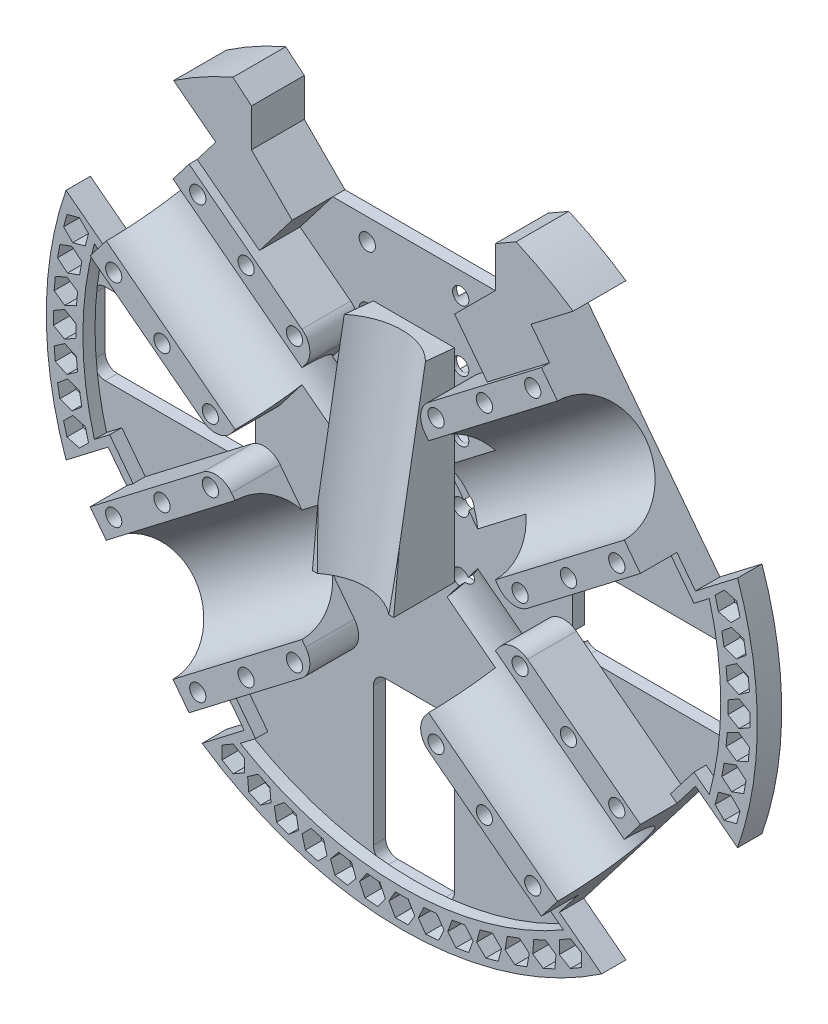
from build123d import *
from build123d.topology import SkipClean

# Parameters (mm, degrees)
SKETCH1_R                                  = 87.5
BOSS_EXTRUDE1_DEPTH                        = 3
CUT_EXTRUDE1_DEPTH                         = 3
BOSS_EXTRUDE2_DEPTH                        = 12
SKETCH4_R                                  = 13.5
CUT_EXTRUDE2_DEPTH                         = 55
SKETCH5_R                                  = 2
CUT_EXTRUDE3_DEPTH                         = 125.649508623
LPATTERN1_COUNT                            = 3
LPATTERN1_PITCH                            = 15
MIRROR3_COPY_1_SKETCH_R                    = 2
MIRROR3_COPY_1_DEPTH                       = 125.649508623
MIRROR3_COPY_2_SKETCH_R                    = 2
MIRROR3_COPY_2_DEPTH                       = 125.649508623
MIRROR3_AT_THE_SECOND_PLANE_COPY_1_SKETC_R = 2
MIRROR3_AT_THE_SECOND_PLANE_COPY_1_DEPTH   = 125.649508623
MIRROR3_AT_THE_SECOND_PLANE_COPY_2_SKETC_R = 2
MIRROR3_AT_THE_SECOND_PLANE_COPY_2_DEPTH   = 125.649508623
MIRROR3_AT_THE_SECOND_PLANE_COPY_3_DEPTH   = 3
MIRROR3_AT_THE_SECOND_PLANE_COPY_4_DEPTH   = 12
MIRROR3_AT_THE_SECOND_PLANE_COPY_5_SKETC_R = 13.5
MIRROR3_AT_THE_SECOND_PLANE_COPY_5_DEPTH   = 55
MIRROR3_AT_THE_SECOND_PLANE_COPY_6_SKETC_R = 2
MIRROR3_AT_THE_SECOND_PLANE_COPY_6_DEPTH   = 125.649508623
MIRROR3_AT_THE_SECOND_PLANE_COPY_7_SKETC_R = 2
MIRROR3_AT_THE_SECOND_PLANE_COPY_7_DEPTH   = 125.649508623
MIRROR3_AT_THE_SECOND_PLANE_COPY_8_SKETC_R = 2
MIRROR3_AT_THE_SECOND_PLANE_COPY_8_DEPTH   = 125.649508623
FILLET2_R                                  = 5
BOSS_EXTRUDE3_DEPTH                        = 3
SKETCH8_R                                  = 1.75
CUT_EXTRUDE4_DEPTH                         = 125.07054445
CUT_EXTRUDE5_DEPTH                         = 4
CIRPATTERN1_COUNT                          = 4
CIRPATTERN1_ANGLE                          = 15
CIRPATTERN1_THE_OTHER_WAY_COUNT            = 4
CIRPATTERN1_THE_OTHER_WAY_ANGLE            = 15
MIRROR4_COPY_1_SKETCH_R                    = 1.75
MIRROR4_COPY_1_DEPTH                       = 125.07054445
MIRROR4_COPY_2_SKETCH_R                    = 1.75
MIRROR4_COPY_2_DEPTH                       = 125.07054445
MIRROR4_COPY_3_SKETCH_R                    = 1.75
MIRROR4_COPY_3_DEPTH                       = 125.07054445
MIRROR4_COPY_4_DEPTH                       = 4
MIRROR4_COPY_5_DEPTH                       = 4
MIRROR4_COPY_6_DEPTH                       = 4
MIRROR4_COPY_7_SKETCH_R                    = 1.75
MIRROR4_COPY_7_DEPTH                       = 125.07054445
MIRROR4_COPY_8_SKETCH_R                    = 1.75
MIRROR4_COPY_8_DEPTH                       = 125.07054445
MIRROR4_COPY_9_SKETCH_R                    = 1.75
MIRROR4_COPY_9_DEPTH                       = 125.07054445
MIRROR4_COPY_10_DEPTH                      = 4
MIRROR4_COPY_11_DEPTH                      = 4
MIRROR4_COPY_12_DEPTH                      = 4
BOSS_EXTRUDE4_DEPTH                        = 3
SKETCH11_R                                 = 1.75
CUT_EXTRUDE6_DEPTH                         = 125.07054445
CUT_EXTRUDE7_DEPTH                         = 4
CIRPATTERN2_COUNT                          = 7
CIRPATTERN2_ANGLE                          = 30
CIRPATTERN2_THE_OTHER_WAY_COUNT            = 7
CIRPATTERN2_THE_OTHER_WAY_ANGLE            = 30
CUT_EXTRUDE8_DEPTH                         = 125.324173032
BOSS_EXTRUDE5_DEPTH                        = 3
CUT_EXTRUDE9_DEPTH                         = 125.324173032
CHAMFER2_SIZE                              = 5.648359349
CHAMFER2_SIZE_2                            = 5
BOSS_EXTRUDE6_DEPTH                        = 10
BOSS_EXTRUDE6_DEPTH_BACK                   = 10
CUT_SWEEP1_PROFILE_R                       = 14
BOSS_EXTRUDE8_DEPTH                        = 10
CUT_EXTRUDE10_DEPTH                        = 2
SKETCH41_R                                 = 2
CUT_EXTRUDE11_DEPTH                        = 125.649508623
LPATTERN2_COUNT                            = 5
LPATTERN2_PITCH                            = 15
CUT_EXTRUDE12_START                        = -2
CUT_EXTRUDE12_DEPTH                        = 2


with BuildPart() as part:
    # Sketch1 → Boss-Extrude1 (new body)
    with BuildSketch(Plane.XY):
        Circle(SKETCH1_R)
    extrude(amount=BOSS_EXTRUDE1_DEPTH)

    # Sketch2 → Cut-Extrude1 (cut)
    with BuildSketch(Plane.XY.offset(3)):
        Polygon((-100.043040028, 42.102733188), (-72.275673118, 20.796083173), (-38.793794523, 64.430516889), (-66.561161433, 85.737166904), align=None)
    cut_extrude1 = extrude(amount=-CUT_EXTRUDE1_DEPTH, mode=Mode.SUBTRACT)

    # Sketch3 → Boss-Extrude2 (add)
    with BuildSketch(Plane.XY.offset(3)):
        Polygon((-35.975828789, 2.395776064), (-67.709962401, 26.746233225), (-43.35950524, 58.480366836), (-11.625371629, 34.129909676), align=None)
    boss_extrude2 = extrude(amount=BOSS_EXTRUDE2_DEPTH)

    # Sketch4 → Cut-Extrude2 (cut)
    with BuildSketch(Plane(origin=(-55.53473382, 42.613300031, 0), x_dir=(0, 0, 1), z_dir=(-0.7933533402912385, 0.6087614290087163, 0))):
        with Locations((15, 0)):
            Circle(SKETCH4_R)
    cut_extrude2 = extrude(amount=-CUT_EXTRUDE2_DEPTH, mode=Mode.SUBTRACT)

    # Sketch5 → Cut-Extrude3 (cut, through all)
    with BuildSketch(Plane.XY.offset(15)):
        with Locations((-61.916911412, 26.082486101)):
            Circle(SKETCH5_R)
        with Locations((-41.219022826, 53.056499671)):
            Circle(SKETCH5_R)
    cut_extrude3 = extrude(amount=-CUT_EXTRUDE3_DEPTH, mode=Mode.SUBTRACT)

    # LPattern1: Cut-Extrude3 ×3
    with Locations(*[Vector(0.7933533402912389, -0.6087614290087158, 0) * (i * LPATTERN1_PITCH) for i in range(1, LPATTERN1_COUNT)]):
        add(cut_extrude3, mode=Mode.SUBTRACT)

    # Mirror3: Cut-Extrude1, Boss-Extrude2, Cut-Extrude2, Cut-Extrude3 across plane
    add(cut_extrude1.mirror(Plane(origin=(0, 0, 0), x_dir=(0, 0, 1), z_dir=(1, 0, 0))), mode=Mode.SUBTRACT)
    add(boss_extrude2.mirror(Plane(origin=(0, 0, 0), x_dir=(0, 0, 1), z_dir=(1, 0, 0))))
    add(cut_extrude2.mirror(Plane(origin=(0, 0, 0), x_dir=(0, 0, 1), z_dir=(1, 0, 0))), mode=Mode.SUBTRACT)
    add(cut_extrude3.mirror(Plane(origin=(0, 0, 0), x_dir=(0, 0, 1), z_dir=(1, 0, 0))), mode=Mode.SUBTRACT)

    # Mirror3 copy 1 sketch → Mirror3 copy 1 (cut, through all)
    with BuildSketch(Plane(origin=(-11.900300104, -9.131421435, 15), x_dir=(-1, 0, 0), z_dir=(0, 0, 1))):
        with Locations((-61.916911412, -26.082486101)):
            Circle(MIRROR3_COPY_1_SKETCH_R)
        with Locations((-41.219022826, -53.056499671)):
            Circle(MIRROR3_COPY_1_SKETCH_R)
    extrude(amount=-MIRROR3_COPY_1_DEPTH, mode=Mode.SUBTRACT)

    # Mirror3 copy 2 sketch → Mirror3 copy 2 (cut, through all)
    with BuildSketch(Plane(origin=(-23.800600209, -18.26284287, 15), x_dir=(-1, 0, 0), z_dir=(0, 0, 1))):
        with Locations((-61.916911412, -26.082486101)):
            Circle(MIRROR3_COPY_2_SKETCH_R)
        with Locations((-41.219022826, -53.056499671)):
            Circle(MIRROR3_COPY_2_SKETCH_R)
    extrude(amount=-MIRROR3_COPY_2_DEPTH, mode=Mode.SUBTRACT)

    # Mirror3 at the second plane: Cut-Extrude1, Boss-Extrude2, Cut-Extrude2, Cut-Extrude3 across plane
    add(cut_extrude1.mirror(Plane.ZX), mode=Mode.SUBTRACT)
    add(boss_extrude2.mirror(Plane.ZX))
    add(cut_extrude2.mirror(Plane.ZX), mode=Mode.SUBTRACT)
    add(cut_extrude3.mirror(Plane.ZX), mode=Mode.SUBTRACT)

    # Mirror3 at the second plane copy 1 sketc → Mirror3 at the second plane copy 1 (cut, through all)
    with BuildSketch(Plane(origin=(11.900300104, 9.131421435, 15), x_dir=(1, 0, 0), z_dir=(0, 0, 1))):
        with Locations((-61.916911412, -26.082486101)):
            Circle(MIRROR3_AT_THE_SECOND_PLANE_COPY_1_SKETC_R)
        with Locations((-41.219022826, -53.056499671)):
            Circle(MIRROR3_AT_THE_SECOND_PLANE_COPY_1_SKETC_R)
    extrude(amount=-MIRROR3_AT_THE_SECOND_PLANE_COPY_1_DEPTH, mode=Mode.SUBTRACT)

    # Mirror3 at the second plane copy 2 sketc → Mirror3 at the second plane copy 2 (cut, through all)
    with BuildSketch(Plane(origin=(23.800600209, 18.26284287, 15), x_dir=(1, 0, 0), z_dir=(0, 0, 1))):
        with Locations((-61.916911412, -26.082486101)):
            Circle(MIRROR3_AT_THE_SECOND_PLANE_COPY_2_SKETC_R)
        with Locations((-41.219022826, -53.056499671)):
            Circle(MIRROR3_AT_THE_SECOND_PLANE_COPY_2_SKETC_R)
    extrude(amount=-MIRROR3_AT_THE_SECOND_PLANE_COPY_2_DEPTH, mode=Mode.SUBTRACT)

    # Mirror3 at the second plane copy 3 sketc → Mirror3 at the second plane copy 3 (cut)
    with BuildSketch(Plane(origin=(0, 0, 3), x_dir=(-1, 0, 0), z_dir=(0, 0, 1))):
        Polygon((-100.043040028, 42.102733188), (-72.275673118, 20.796083173), (-38.793794523, 64.430516889), (-66.561161433, 85.737166904), align=None)
    extrude(amount=-MIRROR3_AT_THE_SECOND_PLANE_COPY_3_DEPTH, mode=Mode.SUBTRACT)

    # Mirror3 at the second plane copy 4 sketc → Mirror3 at the second plane copy 4 (add)
    with BuildSketch(Plane(origin=(0, 0, 3), x_dir=(-1, 0, 0), z_dir=(0, 0, 1))):
        Polygon((-35.975828789, 2.395776064), (-67.709962401, 26.746233225), (-43.35950524, 58.480366836), (-11.625371629, 34.129909676), align=None)
    extrude(amount=MIRROR3_AT_THE_SECOND_PLANE_COPY_4_DEPTH)

    # Mirror3 at the second plane copy 5 sketc → Mirror3 at the second plane copy 5 (cut)
    with BuildSketch(Plane(origin=(55.53473382, -42.613300031, 0), x_dir=(0, 0, 1), z_dir=(0.7933533402912385, -0.6087614290087163, 0))):
        with Locations((15, 0)):
            Circle(MIRROR3_AT_THE_SECOND_PLANE_COPY_5_SKETC_R)
    extrude(amount=-MIRROR3_AT_THE_SECOND_PLANE_COPY_5_DEPTH, mode=Mode.SUBTRACT)

    # Mirror3 at the second plane copy 6 sketc → Mirror3 at the second plane copy 6 (cut, through all)
    with BuildSketch(Plane(origin=(0, 0, 15), x_dir=(-1, 0, 0), z_dir=(0, 0, 1))):
        with Locations((-61.916911412, 26.082486101)):
            Circle(MIRROR3_AT_THE_SECOND_PLANE_COPY_6_SKETC_R)
        with Locations((-41.219022826, 53.056499671)):
            Circle(MIRROR3_AT_THE_SECOND_PLANE_COPY_6_SKETC_R)
    extrude(amount=-MIRROR3_AT_THE_SECOND_PLANE_COPY_6_DEPTH, mode=Mode.SUBTRACT)

    # Mirror3 at the second plane copy 7 sketc → Mirror3 at the second plane copy 7 (cut, through all)
    with BuildSketch(Plane(origin=(-11.900300104, 9.131421435, 15), x_dir=(-1, 0, 0), z_dir=(0, 0, 1))):
        with Locations((-61.916911412, 26.082486101)):
            Circle(MIRROR3_AT_THE_SECOND_PLANE_COPY_7_SKETC_R)
        with Locations((-41.219022826, 53.056499671)):
            Circle(MIRROR3_AT_THE_SECOND_PLANE_COPY_7_SKETC_R)
    extrude(amount=-MIRROR3_AT_THE_SECOND_PLANE_COPY_7_DEPTH, mode=Mode.SUBTRACT)

    # Mirror3 at the second plane copy 8 sketc → Mirror3 at the second plane copy 8 (cut, through all)
    with BuildSketch(Plane(origin=(-23.800600209, 18.26284287, 15), x_dir=(-1, 0, 0), z_dir=(0, 0, 1))):
        with Locations((-61.916911412, 26.082486101)):
            Circle(MIRROR3_AT_THE_SECOND_PLANE_COPY_8_SKETC_R)
        with Locations((-41.219022826, 53.056499671)):
            Circle(MIRROR3_AT_THE_SECOND_PLANE_COPY_8_SKETC_R)
    extrude(amount=-MIRROR3_AT_THE_SECOND_PLANE_COPY_8_DEPTH, mode=Mode.SUBTRACT)

    # Fillet2
    fillet2_edges = [part.edges().sort_by_distance(p)[0] for p in [
        (-11.625371629, -34.129909676, 9),
        (-35.975828789, -2.395776064, 9),
        (11.625371629, 34.129909676, 9),
        (35.975828789, 2.395776064, 9),
        (35.975828789, -2.395776064, 9),
        (11.625371629, -34.129909676, 9),
        (-35.975828789, 2.395776064, 9),
        (-11.625371629, 34.129909676, 9),
    ]]
    fillet(fillet2_edges, radius=FILLET2_R)

    # Sketch7 → Boss-Extrude3 (add)
    with BuildSketch(Plane.XY.offset(3)):
        with BuildLine():
            Line((-75.072644904, -22.942275108), (-82.64181718, -28.750305272))
            ThreePointArc((-82.64181718, -28.750305272), (-87.5, 0), (-82.64181718, 28.750305272))
            Line((-82.64181718, 28.750305272), (-75.072644904, 22.942275108))
            ThreePointArc((-75.072644904, 22.942275108), (-78.5, 0), (-75.072644904, -22.942275108))
        make_face()
    boss_extrude3 = extrude(amount=BOSS_EXTRUDE3_DEPTH)

    # Sketch8 → Cut-Extrude4 (cut, through all)
    with SkipClean():  # the faces are left unmerged after this step: merging them gives an invalid solid
        with BuildSketch(Plane.XY.offset(6)):
            with Locations((-83, 0)):
                Circle(SKETCH8_R)
        cut_extrude4 = extrude(amount=-CUT_EXTRUDE4_DEPTH, mode=Mode.SUBTRACT)

    # Sketch9 → Cut-Extrude5 (cut)
    with SkipClean():  # the faces are left unmerged after this step: merging them gives an invalid solid
        with BuildSketch(Plane.XY.offset(6)):
            Polygon((-83, -3.175426481), (-80.25, -1.58771324), (-80.25, 1.58771324), (-83, 3.175426481), (-85.75, 1.58771324), (-85.75, -1.58771324), align=None)
        cut_extrude5 = extrude(amount=-CUT_EXTRUDE5_DEPTH, mode=Mode.SUBTRACT)

    # CirPattern1: Cut-Extrude4, Cut-Extrude5 ×4 about axis
    with SkipClean():  # the faces are left unmerged after this step: merging them gives an invalid solid
        cirpattern1_axis = Axis((0, 0, 0), (0, 0, 1))
        add([cut_extrude4.rotate(cirpattern1_axis, i * CIRPATTERN1_ANGLE / (CIRPATTERN1_COUNT - 1)) for i in range(1, CIRPATTERN1_COUNT)], mode=Mode.SUBTRACT)
        add([cut_extrude5.rotate(cirpattern1_axis, i * CIRPATTERN1_ANGLE / (CIRPATTERN1_COUNT - 1)) for i in range(1, CIRPATTERN1_COUNT)], mode=Mode.SUBTRACT)

    # CirPattern1 the other way: Cut-Extrude4, Cut-Extrude5 ×4 about axis
    with SkipClean():  # the faces are left unmerged after this step: merging them gives an invalid solid
        cirpattern1_the_other_way_axis = Axis((0, 0, 0), (0, 0, -1))
        add([cut_extrude4.rotate(cirpattern1_the_other_way_axis, i * CIRPATTERN1_THE_OTHER_WAY_ANGLE / (CIRPATTERN1_THE_OTHER_WAY_COUNT - 1)) for i in range(1, CIRPATTERN1_THE_OTHER_WAY_COUNT)], mode=Mode.SUBTRACT)
        add([cut_extrude5.rotate(cirpattern1_the_other_way_axis, i * CIRPATTERN1_THE_OTHER_WAY_ANGLE / (CIRPATTERN1_THE_OTHER_WAY_COUNT - 1)) for i in range(1, CIRPATTERN1_THE_OTHER_WAY_COUNT)], mode=Mode.SUBTRACT)

    # Mirror4: Boss-Extrude3, Cut-Extrude4, Cut-Extrude5 across plane
    with SkipClean():  # the faces are left unmerged after this step: merging them gives an invalid solid
        add(boss_extrude3.mirror(Plane(origin=(0, 0, 0), x_dir=(0, 0, 1), z_dir=(1, 0, 0))))
        add(cut_extrude4.mirror(Plane(origin=(0, 0, 0), x_dir=(0, 0, 1), z_dir=(1, 0, 0))), mode=Mode.SUBTRACT)
        add(cut_extrude5.mirror(Plane(origin=(0, 0, 0), x_dir=(0, 0, 1), z_dir=(1, 0, 0))), mode=Mode.SUBTRACT)

    # Mirror4 copy 1 sketch → Mirror4 copy 1 (cut, through all)
    with SkipClean():  # the faces are left unmerged after this step: merging them gives an invalid solid
        with BuildSketch(Plane(origin=(0, 0, 6), x_dir=(-0.9961946980917455, 0.08715574274765837, 0), z_dir=(0, 0, 1))):
            with Locations((-83, 0)):
                Circle(MIRROR4_COPY_1_SKETCH_R)
        extrude(amount=-MIRROR4_COPY_1_DEPTH, mode=Mode.SUBTRACT)

    # Mirror4 copy 2 sketch → Mirror4 copy 2 (cut, through all)
    with SkipClean():  # the faces are left unmerged after this step: merging them gives an invalid solid
        with BuildSketch(Plane(origin=(0, 0, 6), x_dir=(-0.984807753012208, 0.17364817766693075, 0), z_dir=(0, 0, 1))):
            with Locations((-83, 0)):
                Circle(MIRROR4_COPY_2_SKETCH_R)
        extrude(amount=-MIRROR4_COPY_2_DEPTH, mode=Mode.SUBTRACT)

    # Mirror4 copy 3 sketch → Mirror4 copy 3 (cut, through all)
    with SkipClean():  # the faces are left unmerged after this step: merging them gives an invalid solid
        with BuildSketch(Plane(origin=(0, 0, 6), x_dir=(-0.9659258262890681, 0.2588190451025214, 0), z_dir=(0, 0, 1))):
            with Locations((-83, 0)):
                Circle(MIRROR4_COPY_3_SKETCH_R)
        extrude(amount=-MIRROR4_COPY_3_DEPTH, mode=Mode.SUBTRACT)

    # Mirror4 copy 4 sketch → Mirror4 copy 4 (cut)
    with SkipClean():  # the faces are left unmerged after this step: merging them gives an invalid solid
        with BuildSketch(Plane(origin=(0, 0, 6), x_dir=(-0.9961946980917455, 0.08715574274765837, 0), z_dir=(0, 0, 1))):
            Polygon((-83, 3.175426481), (-80.25, 1.58771324), (-80.25, -1.58771324), (-83, -3.175426481), (-85.75, -1.58771324), (-85.75, 1.58771324), align=None)
        extrude(amount=-MIRROR4_COPY_4_DEPTH, mode=Mode.SUBTRACT)

    # Mirror4 copy 5 sketch → Mirror4 copy 5 (cut)
    with SkipClean():  # the faces are left unmerged after this step: merging them gives an invalid solid
        with BuildSketch(Plane(origin=(0, 0, 6), x_dir=(-0.984807753012208, 0.17364817766693075, 0), z_dir=(0, 0, 1))):
            Polygon((-83, 3.175426481), (-80.25, 1.58771324), (-80.25, -1.58771324), (-83, -3.175426481), (-85.75, -1.58771324), (-85.75, 1.58771324), align=None)
        extrude(amount=-MIRROR4_COPY_5_DEPTH, mode=Mode.SUBTRACT)

    # Mirror4 copy 6 sketch → Mirror4 copy 6 (cut)
    with SkipClean():  # the faces are left unmerged after this step: merging them gives an invalid solid
        with BuildSketch(Plane(origin=(0, 0, 6), x_dir=(-0.9659258262890681, 0.2588190451025214, 0), z_dir=(0, 0, 1))):
            Polygon((-83, 3.175426481), (-80.25, 1.58771324), (-80.25, -1.58771324), (-83, -3.175426481), (-85.75, -1.58771324), (-85.75, 1.58771324), align=None)
        extrude(amount=-MIRROR4_COPY_6_DEPTH, mode=Mode.SUBTRACT)

    # Mirror4 copy 7 sketch → Mirror4 copy 7 (cut, through all)
    with SkipClean():  # the faces are left unmerged after this step: merging them gives an invalid solid
        with BuildSketch(Plane(origin=(0, 0, 6), x_dir=(-0.9961946980917455, -0.08715574274765837, 0), z_dir=(0, 0, 1))):
            with Locations((-83, 0)):
                Circle(MIRROR4_COPY_7_SKETCH_R)
        extrude(amount=-MIRROR4_COPY_7_DEPTH, mode=Mode.SUBTRACT)

    # Mirror4 copy 8 sketch → Mirror4 copy 8 (cut, through all)
    with SkipClean():  # the faces are left unmerged after this step: merging them gives an invalid solid
        with BuildSketch(Plane(origin=(0, 0, 6), x_dir=(-0.984807753012208, -0.17364817766693075, 0), z_dir=(0, 0, 1))):
            with Locations((-83, 0)):
                Circle(MIRROR4_COPY_8_SKETCH_R)
        extrude(amount=-MIRROR4_COPY_8_DEPTH, mode=Mode.SUBTRACT)

    # Mirror4 copy 9 sketch → Mirror4 copy 9 (cut, through all)
    with SkipClean():  # the faces are left unmerged after this step: merging them gives an invalid solid
        with BuildSketch(Plane(origin=(0, 0, 6), x_dir=(-0.9659258262890681, -0.2588190451025214, 0), z_dir=(0, 0, 1))):
            with Locations((-83, 0)):
                Circle(MIRROR4_COPY_9_SKETCH_R)
        extrude(amount=-MIRROR4_COPY_9_DEPTH, mode=Mode.SUBTRACT)

    # Mirror4 copy 10 sketch → Mirror4 copy 10 (cut)
    with SkipClean():  # the faces are left unmerged after this step: merging them gives an invalid solid
        with BuildSketch(Plane(origin=(0, 0, 6), x_dir=(-0.9961946980917455, -0.08715574274765837, 0), z_dir=(0, 0, 1))):
            Polygon((-83, 3.175426481), (-80.25, 1.58771324), (-80.25, -1.58771324), (-83, -3.175426481), (-85.75, -1.58771324), (-85.75, 1.58771324), align=None)
        extrude(amount=-MIRROR4_COPY_10_DEPTH, mode=Mode.SUBTRACT)

    # Mirror4 copy 11 sketch → Mirror4 copy 11 (cut)
    with SkipClean():  # the faces are left unmerged after this step: merging them gives an invalid solid
        with BuildSketch(Plane(origin=(0, 0, 6), x_dir=(-0.984807753012208, -0.17364817766693075, 0), z_dir=(0, 0, 1))):
            Polygon((-83, 3.175426481), (-80.25, 1.58771324), (-80.25, -1.58771324), (-83, -3.175426481), (-85.75, -1.58771324), (-85.75, 1.58771324), align=None)
        extrude(amount=-MIRROR4_COPY_11_DEPTH, mode=Mode.SUBTRACT)

    # Mirror4 copy 12 sketch → Mirror4 copy 12 (cut)
    with SkipClean():  # the faces are left unmerged after this step: merging them gives an invalid solid
        with BuildSketch(Plane(origin=(0, 0, 6), x_dir=(-0.9659258262890681, -0.2588190451025214, 0), z_dir=(0, 0, 1))):
            Polygon((-83, 3.175426481), (-80.25, 1.58771324), (-80.25, -1.58771324), (-83, -3.175426481), (-85.75, -1.58771324), (-85.75, 1.58771324), align=None)
        extrude(amount=-MIRROR4_COPY_12_DEPTH, mode=Mode.SUBTRACT)

    # Sketch10 → Boss-Extrude4 (add)
    with BuildSketch(Plane.XY.offset(3)):
        with BuildLine():
            Line((41.590766308, -66.576708824), (49.159938584, -72.384738988))
            ThreePointArc((49.159938584, -72.384738988), (0, -87.5), (-49.159938584, -72.384738988))
            Line((-49.159938584, -72.384738988), (-41.590766308, -66.576708824))
            ThreePointArc((-41.590766308, -66.576708824), (0, -78.5), (41.590766308, -66.576708824))
        make_face()
    extrude(amount=BOSS_EXTRUDE4_DEPTH)

    # Sketch11 → Cut-Extrude6 (cut, through all)
    with BuildSketch(Plane.XY.offset(6)):
        with Locations((0, -83)):
            Circle(SKETCH11_R)
    cut_extrude6 = extrude(amount=-CUT_EXTRUDE6_DEPTH, mode=Mode.SUBTRACT)

    # Sketch12 → Cut-Extrude7 (cut)
    with BuildSketch(Plane.XY.offset(6)):
        Polygon((3.175426481, -83), (1.58771324, -80.25), (-1.58771324, -80.25), (-3.175426481, -83), (-1.58771324, -85.75), (1.58771324, -85.75), align=None)
    cut_extrude7 = extrude(amount=-CUT_EXTRUDE7_DEPTH, mode=Mode.SUBTRACT)

    # CirPattern2: Cut-Extrude6, Cut-Extrude7 ×7 about axis
    cirpattern2_axis = Axis((0, 0, 0), (0, 0, 1))
    add([cut_extrude6.rotate(cirpattern2_axis, i * CIRPATTERN2_ANGLE / (CIRPATTERN2_COUNT - 1)) for i in range(1, CIRPATTERN2_COUNT)], mode=Mode.SUBTRACT)
    add([cut_extrude7.rotate(cirpattern2_axis, i * CIRPATTERN2_ANGLE / (CIRPATTERN2_COUNT - 1)) for i in range(1, CIRPATTERN2_COUNT)], mode=Mode.SUBTRACT)

    # CirPattern2 the other way: Cut-Extrude6, Cut-Extrude7 ×7 about axis
    cirpattern2_the_other_way_axis = Axis((0, 0, 0), (0, 0, -1))
    add([cut_extrude6.rotate(cirpattern2_the_other_way_axis, i * CIRPATTERN2_THE_OTHER_WAY_ANGLE / (CIRPATTERN2_THE_OTHER_WAY_COUNT - 1)) for i in range(1, CIRPATTERN2_THE_OTHER_WAY_COUNT)], mode=Mode.SUBTRACT)
    add([cut_extrude7.rotate(cirpattern2_the_other_way_axis, i * CIRPATTERN2_THE_OTHER_WAY_ANGLE / (CIRPATTERN2_THE_OTHER_WAY_COUNT - 1)) for i in range(1, CIRPATTERN2_THE_OTHER_WAY_COUNT)], mode=Mode.SUBTRACT)

    # Sketch14 → Cut-Extrude8 (cut, through all)
    with BuildSketch(Plane.XY.offset(3)):
        with BuildLine():
            Line((-7, -39), (7, -39))
            ThreePointArc((7, -39), (9.121320344, -39.878679656), (10, -42))
            Line((10, -42), (10, -76))
            ThreePointArc((10, -76), (9.121320344, -78.121320344), (7, -79))
            Line((7, -79), (-7, -79))
            ThreePointArc((-7, -79), (-9.121320344, -78.121320344), (-10, -76))
            Line((-10, -76), (-10, -42))
            ThreePointArc((-10, -42), (-9.121320344, -39.878679656), (-7, -39))
        make_face()
        with BuildLine():
            Line((-76, 10), (-42, 10))
            ThreePointArc((-42, 10), (-39.878679656, 9.121320344), (-39, 7))
            Line((-39, 7), (-39, -7))
            ThreePointArc((-39, -7), (-39.878679656, -9.121320344), (-42, -10))
            Line((-42, -10), (-76, -10))
            ThreePointArc((-76, -10), (-78.121320344, -9.121320344), (-79, -7))
            Line((-79, -7), (-79, 7))
            ThreePointArc((-79, 7), (-78.121320344, 9.121320344), (-76, 10))
        make_face()
        with BuildLine():
            Line((42, 10), (76, 10))
            ThreePointArc((76, 10), (78.121320344, 9.121320344), (79, 7))
            Line((79, 7), (79, -7))
            ThreePointArc((79, -7), (78.121320344, -9.121320344), (76, -10))
            Line((76, -10), (42, -10))
            ThreePointArc((42, -10), (39.878679656, -9.121320344), (39, -7))
            Line((39, -7), (39, 7))
            ThreePointArc((39, 7), (39.878679656, 9.121320344), (42, 10))
        make_face()
    extrude(amount=-CUT_EXTRUDE8_DEPTH, mode=Mode.SUBTRACT)

    # Sketch15 → Boss-Extrude5 (add)
    with BuildSketch(Plane.XY.offset(3)):
        Polygon((-72.275673118, 20.796083173), (-67.709962401, 26.746233225), (-66.12325572, 25.528710367), (-71.906489296, 17.991853634), (-76.290167762, 21.355568428), (-75.072644904, 22.942275108), align=None)
        Polygon((-72.275673118, -20.796083173), (-67.709962401, -26.746233225), (-66.12325572, -25.528710367), (-71.906489296, -17.991853634), (-76.290167762, -21.355568428), (-75.072644904, -22.942275108), align=None)
        Polygon((-38.793794523, -64.430516889), (-41.590766308, -66.576708824), (-40.37324345, -68.163415505), (-35.989564984, -64.799700711), (-41.77279856, -57.262843978), (-43.35950524, -58.480366836), align=None)
    boss_extrude5 = extrude(amount=BOSS_EXTRUDE5_DEPTH)

    # Mirror5: Boss-Extrude5 across plane
    with SkipClean():  # the faces are left unmerged after this step: merging them gives an invalid solid
        add(boss_extrude5.mirror(Plane(origin=(0, 0, 0), x_dir=(0, 0, 1), z_dir=(1, 0, 0))))

    # Sketch16 → Cut-Extrude9 (cut, through all)
    with SkipClean():  # the faces are left unmerged after this step: merging them gives an invalid solid
        with BuildSketch(Plane.XY.offset(3)):
            with BuildLine():
                Line((-30, 82.196411114), (-30, 67.196411114))
                Line((-30, 67.196411114), (-20, 57.196411114))
                Line((-20, 57.196411114), (20, 57.196411114))
                Line((20, 57.196411114), (30, 67.196411114))
                Line((30, 67.196411114), (30, 82.196411114))
                ThreePointArc((30, 82.196411114), (0, 87.5), (-30, 82.196411114))
            make_face()
        extrude(amount=-CUT_EXTRUDE9_DEPTH, mode=Mode.SUBTRACT)

    # Chamfer2
    # the kernel refuses this chamfer: 5.648359349, 5 mm, written as the material it takes off along each edge
    with BuildSketch(Plane(origin=(-30, 82.196411114, 17.490053703), x_dir=(-0.9293727813914577, -0.3691425648834142, 0), z_dir=(0, 0, -1))) as chamfer2_piece_1:
        with BuildLine():
            Line((4.922021162, 0), (CHAMFER2_SIZE * 0.369142564877, -CHAMFER2_SIZE * 0.929372781374))
            Line((CHAMFER2_SIZE * 0.369142564877, -CHAMFER2_SIZE * 0.929372781374), (0, 0))
            ThreePointArc((0, 0), (2.514680474, 0.034599376), (4.922021162, 0))
        make_face()
    extrude(amount=31.980107406, mode=Mode.SUBTRACT)
    with BuildSketch(Plane(origin=(30, 82.196411114, 17.120838412), x_dir=(0, -1, 0), z_dir=(0, 0, -1))) as chamfer2_piece_2:
        with BuildLine():
            Line((CHAMFER2_SIZE_2, 0), (2.049566211, -5.110301226))
            ThreePointArc((2.049566211, -5.110301226), (1.010563037, -2.635993503), (0, 0))
            Line((0, 0), (CHAMFER2_SIZE_2, 0))
        make_face()
    extrude(amount=31.241676823, mode=Mode.SUBTRACT)

    # Sketch17 → Boss-Extrude6 (add, two sides: drawn at the far end of the back side and taken through both)
    with SkipClean():  # the faces are left unmerged after this step: merging them gives an invalid solid
        with BuildSketch(Plane(origin=(0, 0, 0), x_dir=(0, 0, -1), z_dir=(1, 0, 0)).offset(-BOSS_EXTRUDE6_DEPTH_BACK)):
            Polygon((-3, 40), (-3, -10), (-18, -10), (-12.951330978, 40.985399293), align=None)
        extrude(amount=BOSS_EXTRUDE6_DEPTH + BOSS_EXTRUDE6_DEPTH_BACK)

    # Cut-Sweep1: sweep along a path in Sketch18
    with SkipClean():  # the faces are left unmerged after this step: merging them gives an invalid solid
        with BuildLine(Plane(origin=(0, 0, 0), x_dir=(0, 0, -1), z_dir=(1, 0, 0))) as cut_sweep1_path:
            Line((-16.787308542, 59.627485601), (-31.213579585, -22.18796309))
        # Cut-Sweep1 profile (on start of the path) → Cut-Sweep1 (sweep, cut)
        with BuildSketch(Plane(origin=(0, 59.627485601, 16.787308542), x_dir=(0, -0.17364817766693064, -0.984807753012208), z_dir=(0, -0.984807753012208, 0.17364817766693064))):
            Circle(CUT_SWEEP1_PROFILE_R)
        sweep(path=cut_sweep1_path.line, mode=Mode.SUBTRACT)

    # Sketch35 → Boss-Extrude8 (add)
    with SkipClean():  # the faces are left unmerged after this step: merging them gives an invalid solid
        with BuildSketch(Plane.XY.offset(3)):
            with BuildLine():
                Line((43.35950524, 58.480366836), (38.793794523, 64.430516889))
                Line((38.793794523, 64.430516889), (49.159938584, 72.384738988))
                ThreePointArc((49.159938584, 72.384738988), (42.313483684, 76.58863557), (35.110301226, 80.146844902))
                Line((35.110301226, 80.146844902), (30, 77.196411114))
                Line((30, 77.196411114), (30, 67.196411114))
                Line((30, 67.196411114), (20, 57.196411114))
                Line((20, 57.196411114), (28.036707204, 46.722770372))
                Line((28.036707204, 46.722770372), (43.35950524, 58.480366836))
            make_face()
            with BuildLine():
                Line((-30, 67.196411114), (-20, 57.196411114))
                Line((-20, 57.196411114), (-28.036707204, 46.722770372))
                Line((-28.036707204, 46.722770372), (-43.35950524, 58.480366836))
                Line((-43.35950524, 58.480366836), (-38.793794523, 64.430516889))
                Line((-38.793794523, 64.430516889), (-49.159938584, 72.384738988))
                ThreePointArc((-49.159938584, 72.384738988), (-42.057562171, 76.729469334), (-34.574392497, 80.379483598))
                Line((-34.574392497, 80.379483598), (-30, 76.548051765))
                Line((-30, 76.548051765), (-30, 67.196411114))
            make_face()
        extrude(amount=BOSS_EXTRUDE8_DEPTH)

    # Sketch37 → Cut-Extrude10 (cut)
    with SkipClean():  # the faces are left unmerged after this step: merging them gives an invalid solid
        with BuildSketch(Plane(origin=(0, 0, 0), x_dir=(-1, 0, 0), z_dir=(0, 0, -1))):
            with BuildLine():
                Line((-7, 55), (7, 55))
                ThreePointArc((7, 55), (9.121320344, 54.121320344), (10, 52))
                Line((10, 52), (10, 28))
                ThreePointArc((10, 28), (9.121320344, 25.878679656), (7, 25))
                Line((7, 25), (-7, 25))
                ThreePointArc((-7, 25), (-9.121320344, 25.878679656), (-10, 28))
                Line((-10, 28), (-10, 52))
                ThreePointArc((-10, 52), (-9.121320344, 54.121320344), (-7, 55))
            make_face()
        extrude(amount=-CUT_EXTRUDE10_DEPTH, mode=Mode.SUBTRACT)

    # Sketch41 → Cut-Extrude11 (cut, through all)
    with SkipClean():  # the faces are left unmerged after this step: merging them gives an invalid solid
        with BuildSketch(Plane.XY.offset(3)):
            with Locations((11.5, 51.834174795)):
                Circle(SKETCH41_R)
            with Locations((-11.5, 51.834174795)):
                Circle(SKETCH41_R)
        cut_extrude11 = extrude(amount=-CUT_EXTRUDE11_DEPTH, mode=Mode.SUBTRACT)

    # LPattern2: Cut-Extrude11 ×5
    with SkipClean():  # the faces are left unmerged after this step: merging them gives an invalid solid
        with Locations(*[(0, -i * LPATTERN2_PITCH, 0) for i in range(1, LPATTERN2_COUNT)]):
            add(cut_extrude11, mode=Mode.SUBTRACT)

    # Sketch46 → Cut-Extrude12 (cut)
    with SkipClean():  # the faces are left unmerged after this step: merging them gives an invalid solid
        with BuildSketch(Plane(origin=(0, 0, 0), x_dir=(-1, 0, 0), z_dir=(0, 0, -1)).offset(CUT_EXTRUDE12_START)):
            with BuildLine():
                Line((-11.5, 23.834174795), (11.5, 23.834174795))
                ThreePointArc((11.5, 23.834174795), (13.5, 21.834174795), (11.5, 19.834174795))
                Line((11.5, 19.834174795), (-11.5, 19.834174795))
                ThreePointArc((-11.5, 19.834174795), (-13.5, 21.834174795), (-11.5, 23.834174795))
            make_face()
            with BuildLine():
                Line((-11.5, 38.834174795), (11.5, 38.834174795))
                ThreePointArc((11.5, 38.834174795), (13.5, 36.834174795), (11.5, 34.834174795))
                Line((11.5, 34.834174795), (-11.5, 34.834174795))
                ThreePointArc((-11.5, 34.834174795), (-13.5, 36.834174795), (-11.5, 38.834174795))
            make_face()
        extrude(amount=CUT_EXTRUDE12_DEPTH, mode=Mode.SUBTRACT)


solid = part.part
